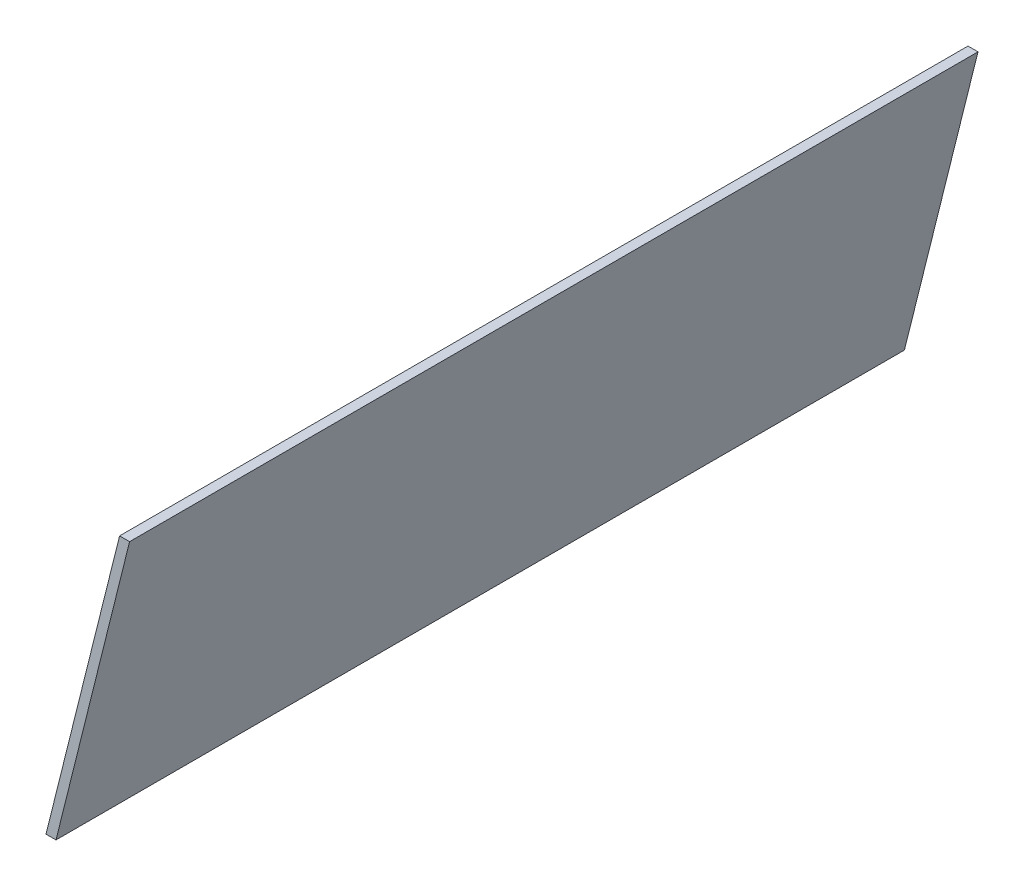
from build123d import *

# Parameters (mm, degrees)
BOSS_EXTRUDE1_DEPTH = 277.475


with BuildPart() as part:
    # Sketch1 → Boss-Extrude1 (new body)
    with BuildSketch(Plane.XY):
        Polygon((-40.901707192, -38.824877845), (-37.629508919, -38.824877845), (-13.563123445, 57.700122155), (-16.835321718, 57.700122155), align=None)
    extrude(amount=BOSS_EXTRUDE1_DEPTH)


solid = part.part
